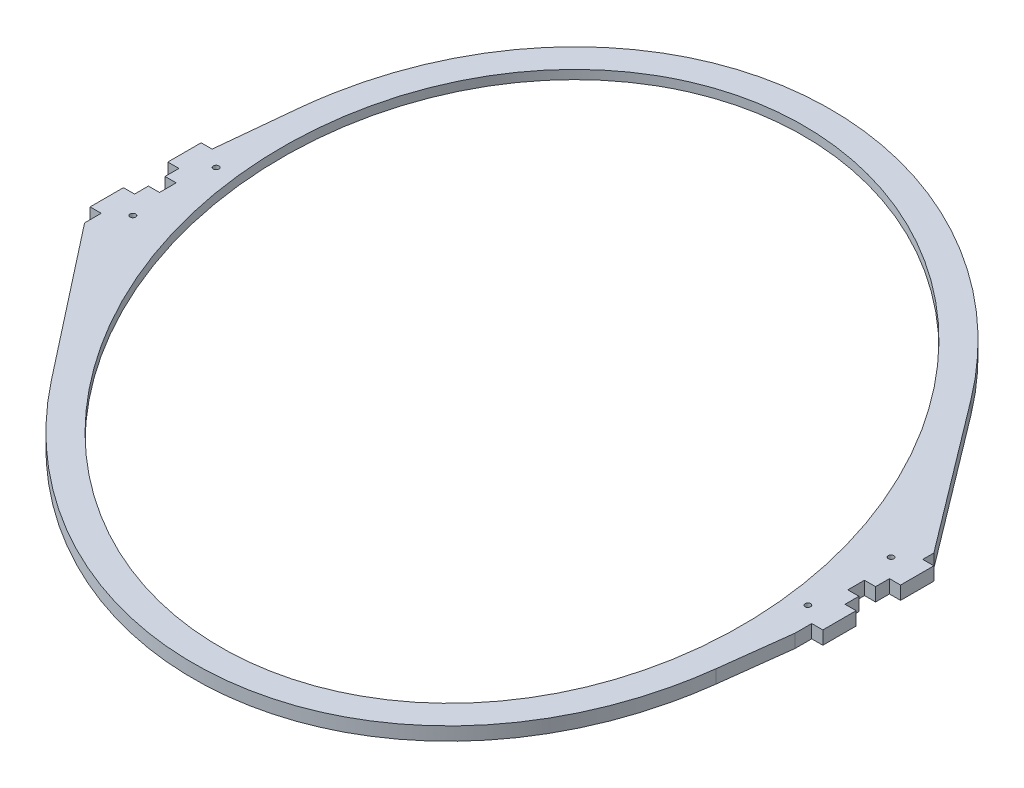
from build123d import *

# Parameters (mm, degrees)
SKETCH1_RX                   = 355
SKETCH1_RY                   = 265
BOSS_EXTRUDE1_DEPTH          = 12
SKETCH2_W                    = 10
SKETCH2_H                    = 15
CUT_EXTRUDE1_DEPTH           = 12
F_5_0_5_DIAMETER_HOLE2_D     = 5
F_5_0_5_DIAMETER_HOLE2_DEPTH = 25
F_5_0_5_DIAMETER_HOLE2_TIP   = 1.502151548
SKETCH9_RX                   = 365
SKETCH9_RY                   = 275
CUT_EXTRUDE4_DEPTH           = 4


with BuildPart() as part:
    # Sketch1 → Boss-Extrude1 (new body)
    with BuildSketch(Plane(origin=(0, 0, 0), x_dir=(1, 0, 0), z_dir=(0, 1, 0))):
        with BuildLine():
            Line((-320, 50), (-320, 51))
            Line((-320, 51), (-313.091302172, 120.09271769))
            add(Edge.make_bspline(
                [(217.547896668, 195.738545202), (-244.337364097, 807.689215884), (-313.091302172, 120.09271769)],
                knots=[4.872921291, 4.872921291, 4.872921291, 7.098478155, 7.098478155, 7.098478155], degree=2, weights=[1, 0.442171166, 1]))
            Line((217.547896668, 195.738545202), (320, 60))
            Line((320, 60), (320, 50))
            Line((320, 50), (330, 50))
            Line((330, 50), (330, 20))
            Line((330, 20), (320, 20))
            Line((320, 20), (320, 0))
            Line((320, 0), (320, -20))
            Line((320, -20), (330, -20))
            Line((330, -20), (330, -50))
            Line((330, -50), (320, -50))
            Line((320, -50), (320, -65))
            Line((320, -65), (312.170159719, -128.33520269))
            add(Edge.make_bspline(
                [(-212.28214963, -202.588475219), (232.721291269, -770.993291043), (312.170159719, -128.33520269)],
                knots=[1.754206291, 1.754206291, 1.754206291, 3.932461359, 3.932461359, 3.932461359], degree=2, weights=[1, 0.463258742, 1]))
            Line((-212.28214963, -202.588475219), (-320, -65))
            Line((-320, -65), (-320, -50))
            Line((-320, -50), (-330, -50))
            Line((-330, -50), (-330, -20))
            Line((-330, -20), (-320, -20))
            Line((-320, -20), (-320, 0))
            Line((-320, 0), (-320, 20))
            Line((-320, 20), (-330, 20))
            Line((-330, 20), (-330, 50))
            Line((-330, 50), (-320, 50))
        make_face()
        with Locations(Location((0, 0), (0, 0, 120))):
            Ellipse(SKETCH1_RX, SKETCH1_RY, mode=Mode.SUBTRACT)
    extrude(amount=BOSS_EXTRUDE1_DEPTH)

    # Sketch2 → Cut-Extrude1 (cut)
    with BuildSketch(Plane(origin=(0, 12, 0), x_dir=(1, 0, 0), z_dir=(0, 1, 0))):
        with Locations((315, 0)):
            Rectangle(SKETCH2_W, SKETCH2_H)
        with Locations((-315, 0)):
            Rectangle(SKETCH2_W, SKETCH2_H)
    extrude(amount=-CUT_EXTRUDE1_DEPTH, mode=Mode.SUBTRACT)

    # Ø5.0 (5) Diameter Hole2
    with Locations(Plane(origin=(0, 12, 0), x_dir=(1, 0, 0), z_dir=(0, 1, 0))):
        with Locations((304, 37.5), (304, -37.5), (-304, -37.5), (-304, 37.5)):
            Hole(F_5_0_5_DIAMETER_HOLE2_D / 2, depth=F_5_0_5_DIAMETER_HOLE2_DEPTH)
            with Locations((0, 0, -(F_5_0_5_DIAMETER_HOLE2_DEPTH + F_5_0_5_DIAMETER_HOLE2_TIP / 2))):  # 118° drill point
                Cone(0, F_5_0_5_DIAMETER_HOLE2_D / 2, F_5_0_5_DIAMETER_HOLE2_TIP, mode=Mode.SUBTRACT)

    # Sketch9 → Cut-Extrude4 (cut)
    with BuildSketch(Plane.XZ):
        with Locations(Location((0, 0), (0, 0, 60.00000001))):
            Ellipse(SKETCH9_RX, SKETCH9_RY)
    extrude(amount=-CUT_EXTRUDE4_DEPTH, mode=Mode.SUBTRACT)


solid = part.part
